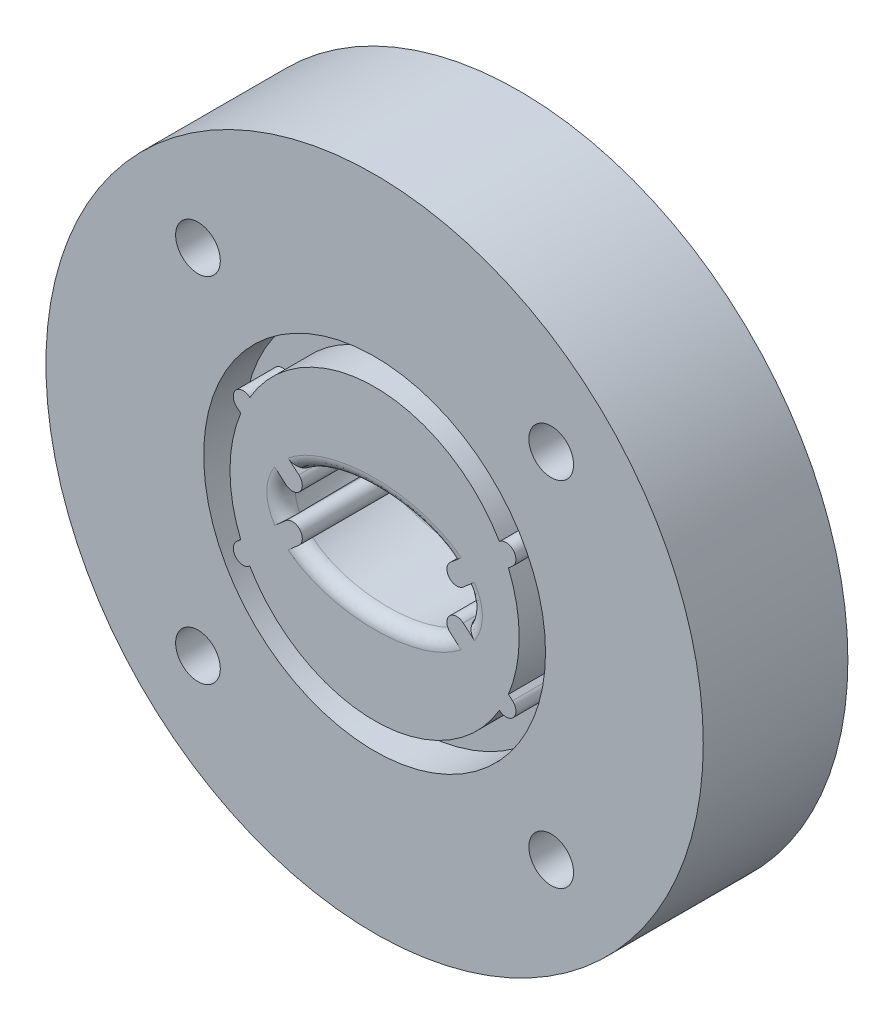
from build123d import *

# Parameters (mm, degrees)
ESQUISSE1_R             = 25
ESQUISSE1_R_2           = 1.7
BOSS_EXTRU_1_DEPTH      = 11
ESQUISSE2_R             = 13
ESQUISSE2_R_2           = 11
ENL_V_MAT_EXTRU_1_DEPTH = 3
CONG_1_R                = 1
ENL_V_START             = -3
ESQUISSE6_R             = 11
ENL_V_MAT_EXTRU_2_DEPTH = 3
CONG_2_R                = 0.5
CONG_3_R                = 0.5
ESQUISSE8_R             = 0.25
BOSS_EXTRU_4_DEPTH      = 10
BOSS_EXTRU_6_DEPTH      = 10


with BuildPart() as part:
    # Esquisse1 → Boss.-Extru.1 (new body)
    with BuildSketch(Plane.XY):
        Circle(ESQUISSE1_R)
        with Locations((-13.435028843, 13.435028843)):
            Circle(ESQUISSE1_R_2, mode=Mode.SUBTRACT)
        with Locations((13.435028843, 13.435028843)):
            Circle(ESQUISSE1_R_2, mode=Mode.SUBTRACT)
        with Locations((13.435028843, -13.435028843)):
            Circle(ESQUISSE1_R_2, mode=Mode.SUBTRACT)
        with Locations((-13.435028843, -13.435028843)):
            Circle(ESQUISSE1_R_2, mode=Mode.SUBTRACT)
    extrude(amount=BOSS_EXTRU_1_DEPTH)

    # Enlèvement de matière-Lissage1: read off the stored shape, not the designer's step
    # Enlèvement de matière-Lissage1: loft between two sections, ruled curve by curve
    enl_vement_de_mati_re_lissage1_from = [
        Edge.make_bspline([(0.092172425, -3.999790223, 0), (18.091228427, -3.917859178, 0), (17.906883578, 4.081721267, 0), (-0.092172425, 3.999790223, 0), (-18.091228427, 3.917859178, 0), (-17.906883578, -4.081721267, 0), (0.092172425, -3.999790223, 0)], [0, 0, 0, 0, 0.5, 0.5, 0.5, 1, 1, 1, 1], 3, [1, 0.333333333, 0.333333333, 1, 0.333333333, 0.333333333, 1]),
    ]
    enl_vement_de_mati_re_lissage1_to = [
        Edge.make_bspline([(-0.165571743, -3.998880905, 11), (13.830511423, -4.188105754, 11), (14.161654909, 3.809656055, 11), (0.165571743, 3.998880905, 11), (-13.830511423, 4.188105754, 11), (-14.161654909, -3.809656055, 11), (-0.165571743, -3.998880905, 11)], [0, 0, 0, 0, 0.5, 0.5, 0.5, 1, 1, 1, 1], 3, [1, 0.333333333, 0.333333333, 1, 0.333333333, 0.333333333, 1]),
    ]
    enl_vement_de_mati_re_lissage1 = Solid(Shell([*[Face.make_surface_from_curves(enl_vement_de_mati_re_lissage1_from[k], enl_vement_de_mati_re_lissage1_to[k]) for k in range(1)], Face(Wire(enl_vement_de_mati_re_lissage1_from)), Face(Wire(enl_vement_de_mati_re_lissage1_to))]))
    add(enl_vement_de_mati_re_lissage1, mode=Mode.SUBTRACT)

    # Esquisse2 → Enlèv. mat.-Extru.1 (cut)
    with BuildSketch(Plane.XY.offset(11)):
        Circle(ESQUISSE2_R)
        Circle(ESQUISSE2_R_2, mode=Mode.SUBTRACT)
    extrude(amount=-ENL_V_MAT_EXTRU_1_DEPTH, mode=Mode.SUBTRACT)

    # Congé1
    cong_1_edges = [part.edges().sort_by_distance(p)[0] for p in [
        (0.165571743, 3.998880905, 11),
    ]]
    fillet(cong_1_edges, radius=CONG_1_R)

    # Esquisse6 → Enlèv. mat.-Extru.2 (cut)
    with BuildSketch(Plane(origin=(0, 0, 0), x_dir=(-1, 0, 0), z_dir=(0, 0, -1)).offset(ENL_V_START)):
        with Locations(Location((0, 0, 0), (0, 0, 180))):
            Circle(ESQUISSE6_R)
    extrude(amount=ENL_V_MAT_EXTRU_2_DEPTH, mode=Mode.SUBTRACT)

    # Congé2
    cong_2_edges = [part.edges().sort_by_distance(p)[0] for p in [
        (-11, 0, 3),
    ]]
    fillet(cong_2_edges, radius=CONG_2_R)

    # Congé3
    cong_3_edges = [part.edges().sort_by_distance(p)[0] for p in [
        (-0.021878558, 3.999542286, 3),
    ]]
    fillet(cong_3_edges, radius=CONG_3_R)

    # Esquisse8 → Boss.-Extru.4 (add)
    with BuildSketch(Plane.XY.offset(11)):
        with Locations((-6.25, 1.75)):
            Circle(ESQUISSE8_R)
        with Locations((-6.25, -1.75)):
            Circle(ESQUISSE8_R)
        with Locations((6.25, 1.75)):
            Circle(ESQUISSE8_R)
        with Locations((6.25, -1.75)):
            Circle(ESQUISSE8_R)
    extrude(amount=-BOSS_EXTRU_4_DEPTH)

    # Esquisse10 → Boss.-Extru.6 (add)
    with BuildSketch(Plane.XY.offset(11)):
        with BuildLine():
            Line((-5.758802096, -2.316766812), (-9.508802096, -5.566766812))
            ThreePointArc((-9.508802096, -5.566766812), (-10.566766812, -5.491197904), (-10.491197904, -4.433233188))
            Line((-10.491197904, -4.433233188), (-6.741197904, -1.183233188))
            ThreePointArc((-6.741197904, -1.183233188), (-5.683233188, -1.258802096), (-5.758802096, -2.316766812))
        make_face()
        with BuildLine():
            Line((-6.741197904, 1.183233188), (-10.491197904, 4.433233188))
            ThreePointArc((-10.491197904, 4.433233188), (-10.566766812, 5.491197904), (-9.508802096, 5.566766812))
            Line((-9.508802096, 5.566766812), (-5.758802096, 2.316766812))
            ThreePointArc((-5.758802096, 2.316766812), (-5.683233188, 1.258802096), (-6.741197904, 1.183233188))
        make_face()
        with BuildLine():
            Line((9.508802096, -5.566766812), (5.758802096, -2.316766812))
            ThreePointArc((5.758802096, -2.316766812), (5.683233188, -1.258802096), (6.741197904, -1.183233188))
            Line((6.741197904, -1.183233188), (10.491197904, -4.433233188))
            ThreePointArc((10.491197904, -4.433233188), (10.566766812, -5.491197904), (9.508802096, -5.566766812))
        make_face()
        with BuildLine():
            Line((10.491197904, 4.433233188), (6.741197904, 1.183233188))
            ThreePointArc((6.741197904, 1.183233188), (5.683233188, 1.258802096), (5.758802096, 2.316766812))
            Line((5.758802096, 2.316766812), (9.508802096, 5.566766812))
            ThreePointArc((9.508802096, 5.566766812), (10.566766812, 5.491197904), (10.491197904, 4.433233188))
        make_face()
    extrude(amount=-BOSS_EXTRU_6_DEPTH)


solid = part.part
